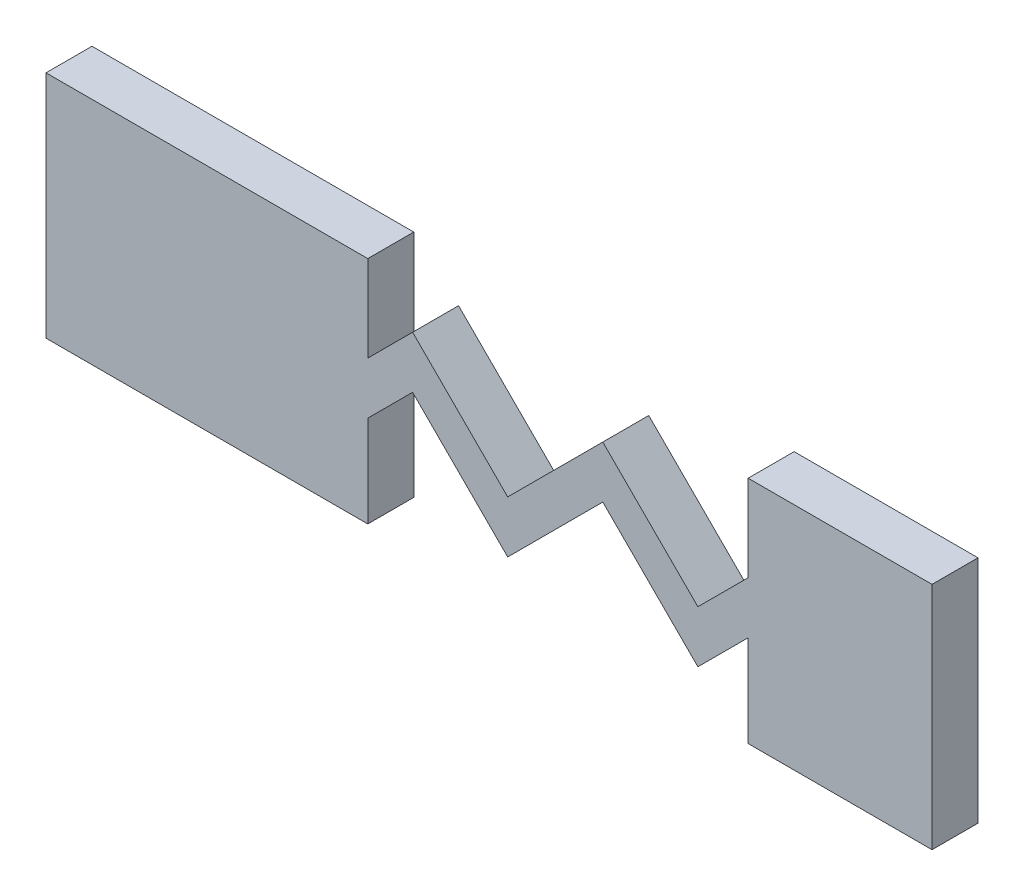
from build123d import *

# Parameters (mm, degrees)
BOSS_EXTRUDE2_DEPTH = 2


with BuildPart() as part:
    # Sketch1 → Boss-Extrude2 (new body)
    with BuildSketch(Plane.XY):
        Polygon((15.95, 8.2), (14, 6.25), (14, 10), (0, 10), (0, 0), (14, 0), (14, 3.9872583), (15.95, 5.9372583), (20.0872583, 1.8), (24.2245166, 5.9372583), (28.361774901, 1.8), (30.549033201, 3.9872583), (30.549033201, 0), (38.549033201, 0), (38.549033201, 10), (30.549033201, 10), (30.549033201, 6.25), (28.361774901, 4.0627417), (24.2245166, 8.2), (20.0872583, 4.0627417), align=None)
    extrude(amount=BOSS_EXTRUDE2_DEPTH)


solid = part.part
